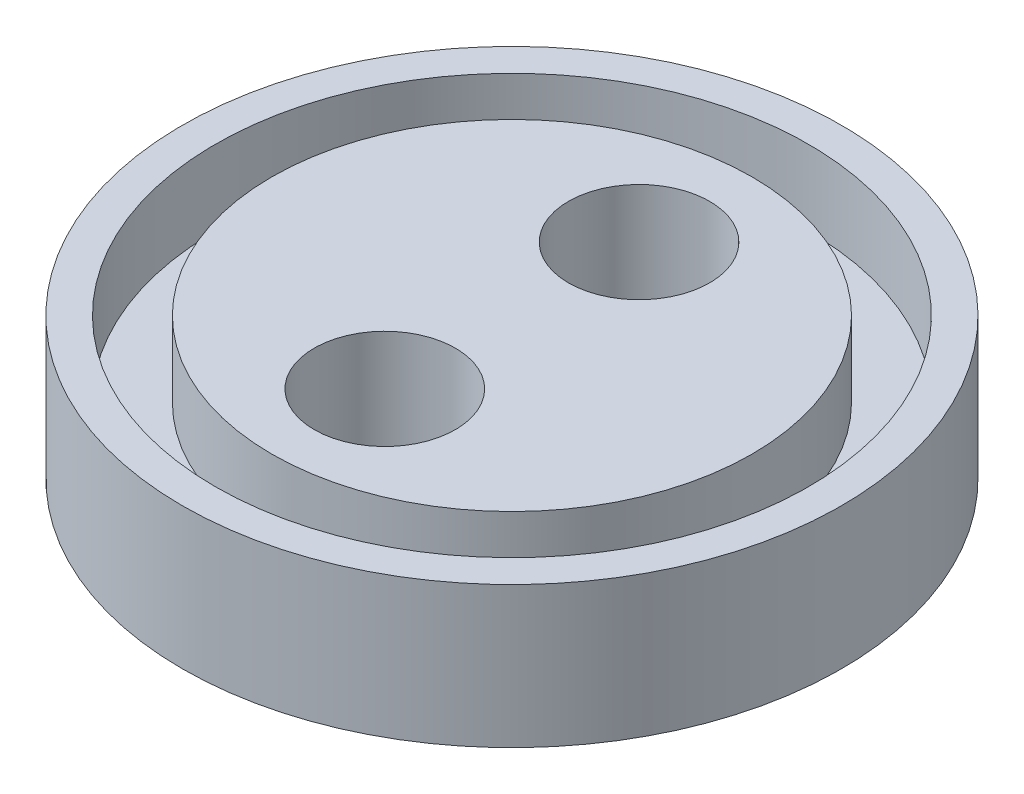
from build123d import *

# Parameters (mm, degrees)
SKETCH4_R        = 17.5
SKETCH4_R_2      = 3.75
LIDBASE_DEPTH    = 7.5
SKETCH5_R        = 15.75
SKETCH5_R_2      = 12.75
LIDGROOVES_DEPTH = 4


with BuildPart() as part:
    # Sketch4 → LidBase (new body)
    with BuildSketch(Plane(origin=(0, 0, 0), x_dir=(1, 0, 0), z_dir=(0, 1, 0))):
        Circle(SKETCH4_R)
        with Locations((0, 6.75)):
            Circle(SKETCH4_R_2, mode=Mode.SUBTRACT)
        with Locations((0, -6.75)):
            Circle(SKETCH4_R_2, mode=Mode.SUBTRACT)
    extrude(amount=LIDBASE_DEPTH)

    # Sketch5 → LidGrooves (cut)
    with BuildSketch(Plane(origin=(0, 7.5, 0), x_dir=(1, 0, 0), z_dir=(0, 1, 0))):
        Circle(SKETCH5_R)
        Circle(SKETCH5_R_2, mode=Mode.SUBTRACT)
    extrude(amount=-LIDGROOVES_DEPTH, mode=Mode.SUBTRACT)


solid = part.part
